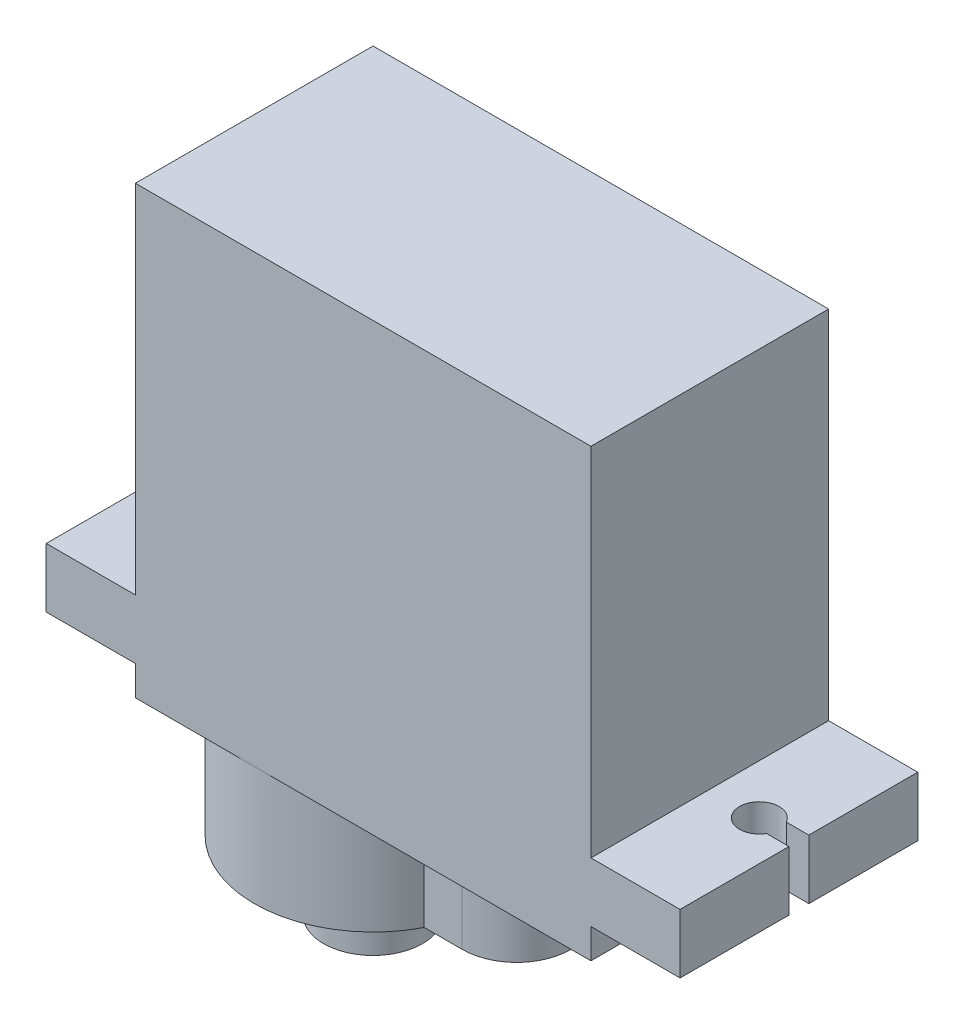
from build123d import *

# Parameters (mm, degrees)
SKETCH_1_W          = 23
SKETCH_1_H          = 12
EXTRUDE_1_DEPTH     = 22.5
SKETCH_3_W          = 32
SKETCH_3_H          = 12
EXTRUDE_2_DEPTH     = 3
CUT_EXTRUDE_1_DEPTH = 3
SKETCH_5_R          = 6
EXTRUDE_3_DEPTH     = 6
SKETCH_6_R          = 2.5
EXTRUDE_4_DEPTH     = 3.5
EXTRUDE_5_DEPTH     = 6
SKETCH_8_W          = 3
SKETCH_8_H          = 0.8
EXTRUDE_6_DEPTH     = 1


with BuildPart() as part:
    # 草图1 → 凸台-拉伸1 (new body)
    with BuildSketch(Plane(origin=(0, 0, 0), x_dir=(1, 0, 0), z_dir=(0, 1, 0))):
        Rectangle(SKETCH_1_W, SKETCH_1_H)
    extrude(amount=EXTRUDE_1_DEPTH)

    # 草图3 → 凸台-拉伸2 (add)
    with BuildSketch(Plane(origin=(0, 4.5, 0), x_dir=(1, 0, 0), z_dir=(0, 1, 0))):
        Rectangle(SKETCH_3_W, SKETCH_3_H)
    extrude(amount=-EXTRUDE_2_DEPTH)

    # 草图4 → 切除-拉伸1 (cut)
    with BuildSketch(Plane.XZ.offset(-1.5)):
        with BuildLine():
            Line((-16.941045567, 0.5), (-14.866025404, 0.5))
            ThreePointArc((-14.866025404, 0.5), (-13, 0), (-14.866025404, -0.5))
            Line((-14.866025404, -0.5), (-16.941045567, -0.5))
            Line((-16.941045567, -0.5), (-16.941045567, 0.5))
        make_face()
        with BuildLine():
            Line((16.941045567, 0.5), (16.941045567, -0.5))
            Line((16.941045567, -0.5), (14.866025404, -0.5))
            ThreePointArc((14.866025404, -0.5), (13, 0), (14.866025404, 0.5))
            Line((14.866025404, 0.5), (16.941045567, 0.5))
        make_face()
    extrude(amount=-CUT_EXTRUDE_1_DEPTH, mode=Mode.SUBTRACT)

    # 草图5 → 凸台-拉伸3 (add)
    with BuildSketch(Plane.XZ):
        with Locations((-5.5, 0)):
            Circle(SKETCH_5_R)
    extrude(amount=EXTRUDE_3_DEPTH)

    # 草图6 → 凸台-拉伸4 (add)
    with BuildSketch(Plane.XZ.offset(6)):
        with Locations((-5.5, 0)):
            Circle(SKETCH_6_R)
    extrude(amount=EXTRUDE_4_DEPTH)

    # 草图7 → 凸台-拉伸5 (add)
    with BuildSketch(Plane(origin=(0, 0, 0), x_dir=(1, 0, 0), z_dir=(0, 1, 0))):
        with BuildLine():
            Line((1.75, -2.75), (-1.67047712, -2.75))
            Line((-1.67047712, -2.75), (-1.67047712, 2.75))
            Line((-1.67047712, 2.75), (1.75, 2.75))
            ThreePointArc((1.75, 2.75), (4.5, 0), (1.75, -2.75))
        make_face()
    extrude(amount=-EXTRUDE_5_DEPTH)

    # 草图8 → 凸台-拉伸6 (add)
    with BuildSketch(Plane.ZY.offset(11.5)):
        with Locations((0, 17.9)):
            Rectangle(SKETCH_8_W, SKETCH_8_H)
    extrude(amount=EXTRUDE_6_DEPTH)


solid = part.part
